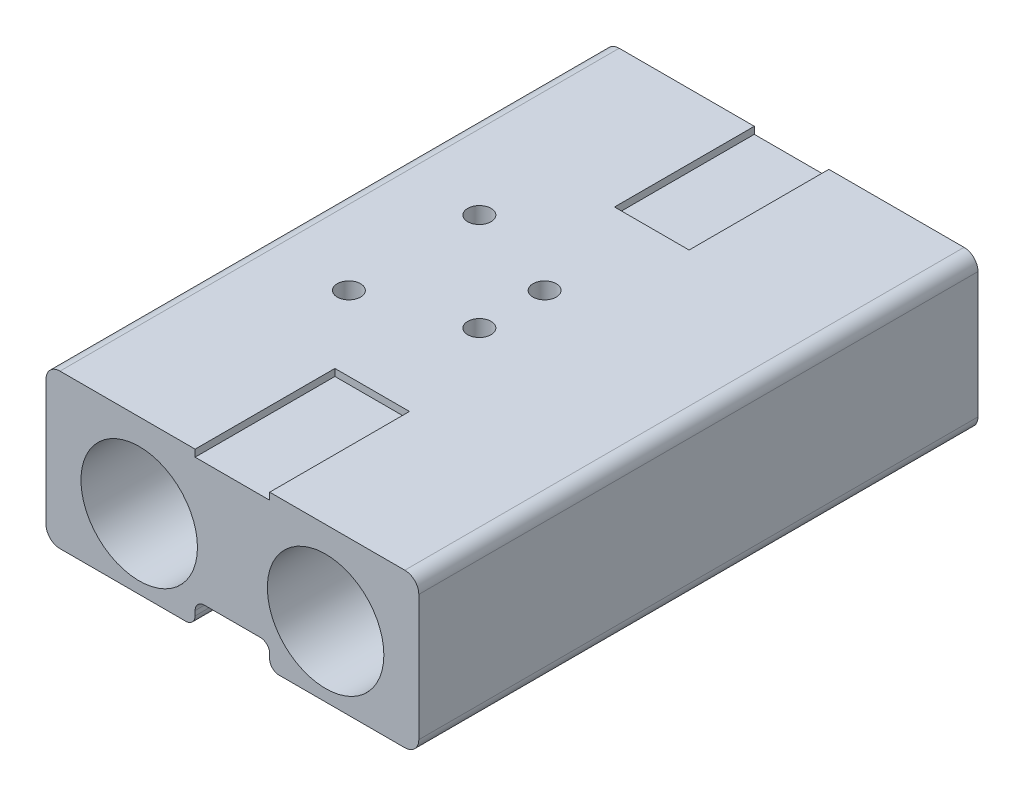
from build123d import *

# Parameters (mm, degrees)
SKETCH_1_R               = 3.5
EXTRUDE_1_DEPTH          = 60
FILLET_1_R               = 1.5
SKETCH_2_R               = 6.25
CUT_EXTRUDE_1_DEPTH      = 20
CUT_EXTRUDE_START        = -20
SKETCH_3_R               = 6.25
CUT_EXTRUDE_2_DEPTH      = 20
SKETCH_5_W               = 8
SKETCH_5_H               = 0.75
CUT_EXTRUDE_4_DEPTH      = 62
FILLET_2_R               = 1
SKETCH_7_W               = 8
SKETCH_7_H               = 30
EXTRUDE_2_DEPTH          = 2
SKETCH_6_R               = 1.25
CUT_EXTRUDE_5_DEPTH      = 62
SKETCH_8_R               = 1.25
CUT_EXTRUDE_6_DEPTH      = 5
CUT_EXTRUDE_9_DEPTH      = 5
CUT_EXTRUDE_9_DEPTH_BACK = 8


with BuildPart() as part:
    # 草图1 → 凸台-拉伸1 (new body)
    with BuildSketch(Plane.XY):
        Polygon((-20, 9), (-20, -7.5), (0, -7.5), (20, -7.5), (20, 9), align=None)
        with Locations((-10, 0)):
            Circle(SKETCH_1_R, mode=Mode.SUBTRACT)
        with Locations((10, 0)):
            Circle(SKETCH_1_R, mode=Mode.SUBTRACT)
    extrude(amount=EXTRUDE_1_DEPTH)

    # 圆角1
    fillet_1_edges = [part.edges().sort_by_distance(p)[0] for p in [
        (-20, 9, 30),
        (20, 9, 30),
        (20, -7.5, 30),
        (-20, -7.5, 30),
    ]]
    fillet(fillet_1_edges, radius=FILLET_1_R)

    # 草图2 → 切除-拉伸1 (cut)
    with BuildSketch(Plane.XY.offset(60)):
        with Locations((10, 0)):
            Circle(SKETCH_2_R)
        with Locations((-10, 0)):
            Circle(SKETCH_2_R)
    extrude(amount=-CUT_EXTRUDE_1_DEPTH, mode=Mode.SUBTRACT)

    # 草图3 → 切除-拉伸2 (cut)
    with BuildSketch(Plane(origin=(0, 0, 0), x_dir=(-1, 0, 0), z_dir=(0, 0, -1)).offset(CUT_EXTRUDE_START)):
        with Locations((-10, 0)):
            Circle(SKETCH_3_R)
        with Locations((10, 0)):
            Circle(SKETCH_3_R)
    extrude(amount=CUT_EXTRUDE_2_DEPTH, mode=Mode.SUBTRACT)

    # 草图5 → 切除-拉伸4 (cut)
    with BuildSketch(Plane(origin=(0, 0, 0), x_dir=(-1, 0, 0), z_dir=(0, 0, -1))):
        Polygon((0, -5), (4, -5), (4, -9), (-4, -9), (-4, -5), align=None)
        with Locations((0, 8.625)):
            Rectangle(SKETCH_5_W, SKETCH_5_H)
    extrude(amount=-CUT_EXTRUDE_4_DEPTH, mode=Mode.SUBTRACT)

    # 圆角2
    fillet_2_edges = [part.edges().sort_by_distance(p)[0] for p in [
        (-4, -5, 30),
        (4, -5, 30),
        (-4, -7.5, 30),
        (4, -7.5, 30),
    ]]
    fillet(fillet_2_edges, radius=FILLET_2_R)

    # 草图7 → 凸台-拉伸2 (add)
    with BuildSketch(Plane(origin=(0, 9, 0), x_dir=(1, 0, 0), z_dir=(0, 1, 0))):
        with Locations((0, -30)):
            Rectangle(SKETCH_7_W, SKETCH_7_H)
    extrude(amount=-EXTRUDE_2_DEPTH)

    # 草图6 → 切除-拉伸5 (cut)
    with BuildSketch(Plane(origin=(0, 9, 0), x_dir=(1, 0, 0), z_dir=(0, 1, 0))):
        with Locations((0, -26.5)):
            Circle(SKETCH_6_R)
        with Locations((0, -33.5)):
            Circle(SKETCH_6_R)
    extrude(amount=-CUT_EXTRUDE_5_DEPTH, mode=Mode.SUBTRACT)

    # 草图8 → 切除-拉伸6 (cut)
    with BuildSketch(Plane(origin=(0, 9, 0), x_dir=(1, 0, 0), z_dir=(0, 1, 0))):
        with Locations((-10.5, -23)):
            Circle(SKETCH_8_R)
        with Locations((-10.5, -37)):
            Circle(SKETCH_8_R)
    extrude(amount=-CUT_EXTRUDE_6_DEPTH, mode=Mode.SUBTRACT)

    # 草图9 → 切除-拉伸9 (cut, two sides: drawn at the far end of the back side and taken through both)
    with BuildSketch(Plane.XZ.offset(5).offset(-CUT_EXTRUDE_9_DEPTH_BACK)):
        with BuildLine():
            Line((2.474873734, 28.974873734), (2.474873734, 31.025126266))
            ThreePointArc((2.474873734, 31.025126266), (0, 37), (-2.474873734, 31.025126266))
            Line((-2.474873734, 31.025126266), (-2.474873734, 28.974873734))
            ThreePointArc((-2.474873734, 28.974873734), (0, 23), (2.474873734, 28.974873734))
        make_face()
    extrude(amount=CUT_EXTRUDE_9_DEPTH + CUT_EXTRUDE_9_DEPTH_BACK, mode=Mode.SUBTRACT)


solid = part.part
